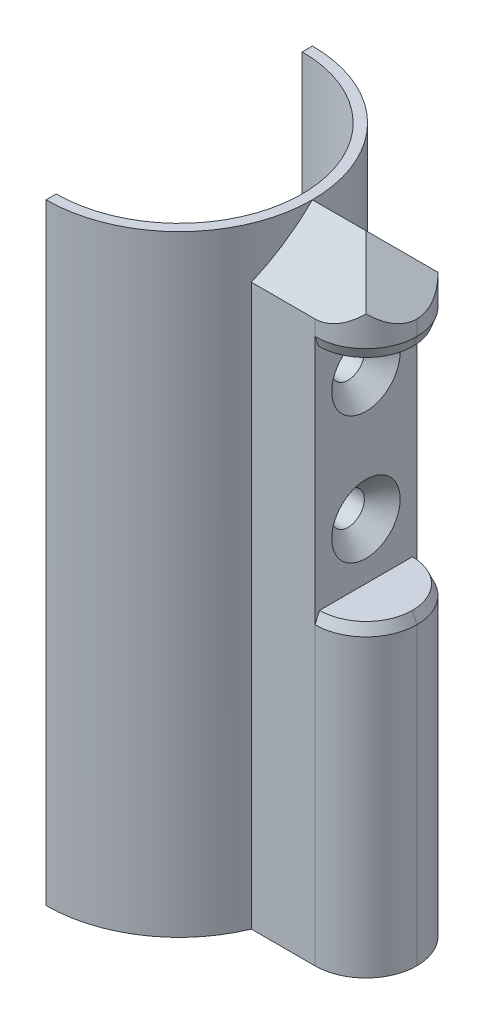
from build123d import *
from OCP.BRepFilletAPI import BRepFilletAPI_MakeChamfer

# Parameters (mm, degrees)
DODANIE_WYCI_GNI_CIE1_DEPTH                        = 100
DODANIE_WYCI_GNI_CIE1_DEPTH_BACK                   = 20
SFAZOWANIE1_SIZE                                   = 10
ZAOKR_GLENIE1_R                                    = 10
SZKIC3_W                                           = 20
SZKIC3_H                                           = 45
WYTNIJ_WYCI_GNI_CIE1_DEPTH                         = 100
SFAZOWANIE2_SIZE                                   = 2
SFAZOWANIE2_SIZE2                                  = 0.890457371
SFAZOWANIE3_SIZE                                   = 2
SFAZOWANIE3_SIZE2                                  = 0.727940469
POG_BIENIE_STO_KOWE_POD_M6_WKR_T_Z_BEM_D           = 6.4
POG_BIENIE_STO_KOWE_POD_M6_WKR_T_Z_BEM_DEPTH       = 40
POG_BIENIE_STO_KOWE_POD_M6_WKR_T_Z_BEM_CSINK_D     = 13.44
POG_BIENIE_STO_KOWE_POD_M6_WKR_T_Z_BEM_CSINK_ANGLE = 90
POG_BIENIE_STO_KOWE_POD_M6_WKR_T_Z_BEM_TIP         = 1.922753981
SZKIC7_R                                           = 5
WYTNIJ_WYCI_GNI_CIE2_DEPTH                         = 50


with BuildPart() as part:
    # Szkic2 → Dodanie-wyciągnięcie1 (new, two sides: drawn at the far end of the back side and taken through both)
    with BuildSketch(Plane(origin=(0, 0, 0), x_dir=(1, 0, 0), z_dir=(0, 1, 0)).offset(-DODANIE_WYCI_GNI_CIE1_DEPTH_BACK)):
        with BuildLine():
            Line((24.162419167, 10), (46.662419167, 10))
            Line((46.662419167, 10), (46.662419167, -10))
            Line((46.662419167, -10), (24.162419167, -10))
            ThreePointArc((24.162419167, -10), (14.53138844, -21.740773905), (0, -26.15))
            Line((0, -26.15), (0, -24.15))
            ThreePointArc((0, -24.15), (24.15, 0), (0, 24.15))
            Line((0, 24.15), (0, 26.15))
            ThreePointArc((0, 26.15), (14.53138844, 21.740773905), (24.162419167, 10))
        make_face()
    extrude(amount=DODANIE_WYCI_GNI_CIE1_DEPTH + DODANIE_WYCI_GNI_CIE1_DEPTH_BACK)

    # Sfazowanie1
    sfazowanie1_edges = [part.edges().sort_by_distance(p)[0] for p in [
        (35.412419167, 100, 10),
        (46.662419167, 100, 0),
        (35.412419167, 100, -10),
    ]]
    chamfer(sfazowanie1_edges, length=SFAZOWANIE1_SIZE - 0.0001)  # a hair under: the kernel refuses the full size

    # Zaokrąglenie1
    zaokr_glenie1_edges = [part.edges().sort_by_distance(p)[0] for p in [
        (46.662419167, 35.00005, -10),
        (46.662419167, 35.00005, 10),
    ]]
    fillet(zaokr_glenie1_edges, radius=ZAOKR_GLENIE1_R - 0.0001)  # a hair under: the kernel refuses the full size

    # Szkic3 → Wytnij-wyciągnięcie1 (cut)
    with BuildSketch(Plane(origin=(36.66, 0, 0), x_dir=(0, 0, -1), z_dir=(1, 0, 0))):
        with Locations((0, 62.5)):
            Rectangle(SZKIC3_W, SZKIC3_H)
    extrude(amount=WYTNIJ_WYCI_GNI_CIE1_DEPTH, mode=Mode.SUBTRACT)

    # Sfazowanie2: one chamfer whose edges measure the first distance from different faces: ONE call of the kernel's chamfer builder (chamfer() names one face for all edges)
    sfazowanie2_edges_1 = [part.edges().sort_by_distance(p)[0] for p in [
        (43.733516268, 40, -7.071097101),
    ]]
    sfazowanie2_side_1 = [part.faces().sort_by_distance(p)[0] for p in [
        (43.733516268, 10, -7.071097101),
    ]]
    sfazowanie2_edges_2 = [part.edges().sort_by_distance(p)[0] for p in [
        (43.733516268, 40, 7.071097101),
    ]]
    sfazowanie2_side_2 = [part.faces().sort_by_distance(p)[0] for p in [
        (43.733516268, 10, 7.071097101),
    ]]
    sfazowanie2_edges_3 = [part.edges().sort_by_distance(p)[0] for p in [
        (36.661259583, 40, -10),
    ]]
    sfazowanie2_side_3 = [part.faces().sort_by_distance(p)[0] for p in [
        (30.411953945, 34.997782587, -10),
    ]]
    sfazowanie2_edges_4 = [part.edges().sort_by_distance(p)[0] for p in [
        (36.661259583, 40, 10),
    ]]
    sfazowanie2_side_4 = [part.faces().sort_by_distance(p)[0] for p in [
        (30.411953945, 34.997782587, 10),
    ]]
    sfazowanie2 = BRepFilletAPI_MakeChamfer(part.part.solid().wrapped)
    for e in sfazowanie2_edges_1:
        sfazowanie2.Add(SFAZOWANIE2_SIZE, SFAZOWANIE2_SIZE2, e.wrapped, sfazowanie2_side_1[0].wrapped)  # the first distance lies on this face
    for e in sfazowanie2_edges_2:
        sfazowanie2.Add(SFAZOWANIE2_SIZE, SFAZOWANIE2_SIZE2, e.wrapped, sfazowanie2_side_2[0].wrapped)  # the first distance lies on this face
    for e in sfazowanie2_edges_3:
        sfazowanie2.Add(SFAZOWANIE2_SIZE, SFAZOWANIE2_SIZE2, e.wrapped, sfazowanie2_side_3[0].wrapped)  # the first distance lies on this face
    for e in sfazowanie2_edges_4:
        sfazowanie2.Add(SFAZOWANIE2_SIZE, SFAZOWANIE2_SIZE2, e.wrapped, sfazowanie2_side_4[0].wrapped)  # the first distance lies on this face
    add(Compound.cast(sfazowanie2.Shape()), mode=Mode.REPLACE)

    # Sfazowanie3: one chamfer whose edges measure the first distance from different faces: ONE call of the kernel's chamfer builder (chamfer() names one face for all edges)
    sfazowanie3_edges_1 = [part.edges().sort_by_distance(p)[0] for p in [
        (43.733516268, 85, -7.071097101),
    ]]
    sfazowanie3_side_1 = [part.faces().sort_by_distance(p)[0] for p in [
        (43.733516268, 88.964501449, -7.071097101),
    ]]
    sfazowanie3_edges_2 = [part.edges().sort_by_distance(p)[0] for p in [
        (43.733516268, 85, 7.071097101),
    ]]
    sfazowanie3_side_2 = [part.faces().sort_by_distance(p)[0] for p in [
        (43.733516268, 88.964501449, 7.071097101),
    ]]
    sfazowanie3_edges_3 = [part.edges().sort_by_distance(p)[0] for p in [
        (36.661259583, 85, -10),
    ]]
    sfazowanie3_side_3 = [part.faces().sort_by_distance(p)[0] for p in [
        (30.411931044, 34.997767921, -10),
    ]]
    sfazowanie3_edges_4 = [part.edges().sort_by_distance(p)[0] for p in [
        (36.661259583, 85, 10),
    ]]
    sfazowanie3_side_4 = [part.faces().sort_by_distance(p)[0] for p in [
        (30.411931044, 34.997767921, 10),
    ]]
    sfazowanie3 = BRepFilletAPI_MakeChamfer(part.part.solid().wrapped)
    for e in sfazowanie3_edges_1:
        sfazowanie3.Add(SFAZOWANIE3_SIZE, SFAZOWANIE3_SIZE2, e.wrapped, sfazowanie3_side_1[0].wrapped)  # the first distance lies on this face
    for e in sfazowanie3_edges_2:
        sfazowanie3.Add(SFAZOWANIE3_SIZE, SFAZOWANIE3_SIZE2, e.wrapped, sfazowanie3_side_2[0].wrapped)  # the first distance lies on this face
    for e in sfazowanie3_edges_3:
        sfazowanie3.Add(SFAZOWANIE3_SIZE, SFAZOWANIE3_SIZE2, e.wrapped, sfazowanie3_side_3[0].wrapped)  # the first distance lies on this face
    for e in sfazowanie3_edges_4:
        sfazowanie3.Add(SFAZOWANIE3_SIZE, SFAZOWANIE3_SIZE2, e.wrapped, sfazowanie3_side_4[0].wrapped)  # the first distance lies on this face
    add(Compound.cast(sfazowanie3.Shape()), mode=Mode.REPLACE)

    # Pogłębienie stożkowe pod M6 Wkręt z łbem stożkowym płaskim2
    with Locations(Plane(origin=(36.66, 0, 0), x_dir=(0, 0, -1), z_dir=(1, 0, 0))):
        with Locations((0, 51), (0, 76)):
            CounterSinkHole(POG_BIENIE_STO_KOWE_POD_M6_WKR_T_Z_BEM_D / 2, POG_BIENIE_STO_KOWE_POD_M6_WKR_T_Z_BEM_CSINK_D / 2, depth=POG_BIENIE_STO_KOWE_POD_M6_WKR_T_Z_BEM_DEPTH, counter_sink_angle=POG_BIENIE_STO_KOWE_POD_M6_WKR_T_Z_BEM_CSINK_ANGLE)
            with Locations((0, 0, -(POG_BIENIE_STO_KOWE_POD_M6_WKR_T_Z_BEM_DEPTH + POG_BIENIE_STO_KOWE_POD_M6_WKR_T_Z_BEM_TIP / 2))):  # 118° drill point
                Cone(0, POG_BIENIE_STO_KOWE_POD_M6_WKR_T_Z_BEM_D / 2, POG_BIENIE_STO_KOWE_POD_M6_WKR_T_Z_BEM_TIP, mode=Mode.SUBTRACT)

    # Szkic7 → Wytnij-wyciągnięcie2 (cut)
    with BuildSketch(Plane.XZ.offset(20)):
        with Locations(Location((37, 0, 0), (0, 0, 270))):
            Circle(SZKIC7_R)
    extrude(amount=-WYTNIJ_WYCI_GNI_CIE2_DEPTH, mode=Mode.SUBTRACT)


solid = part.part
